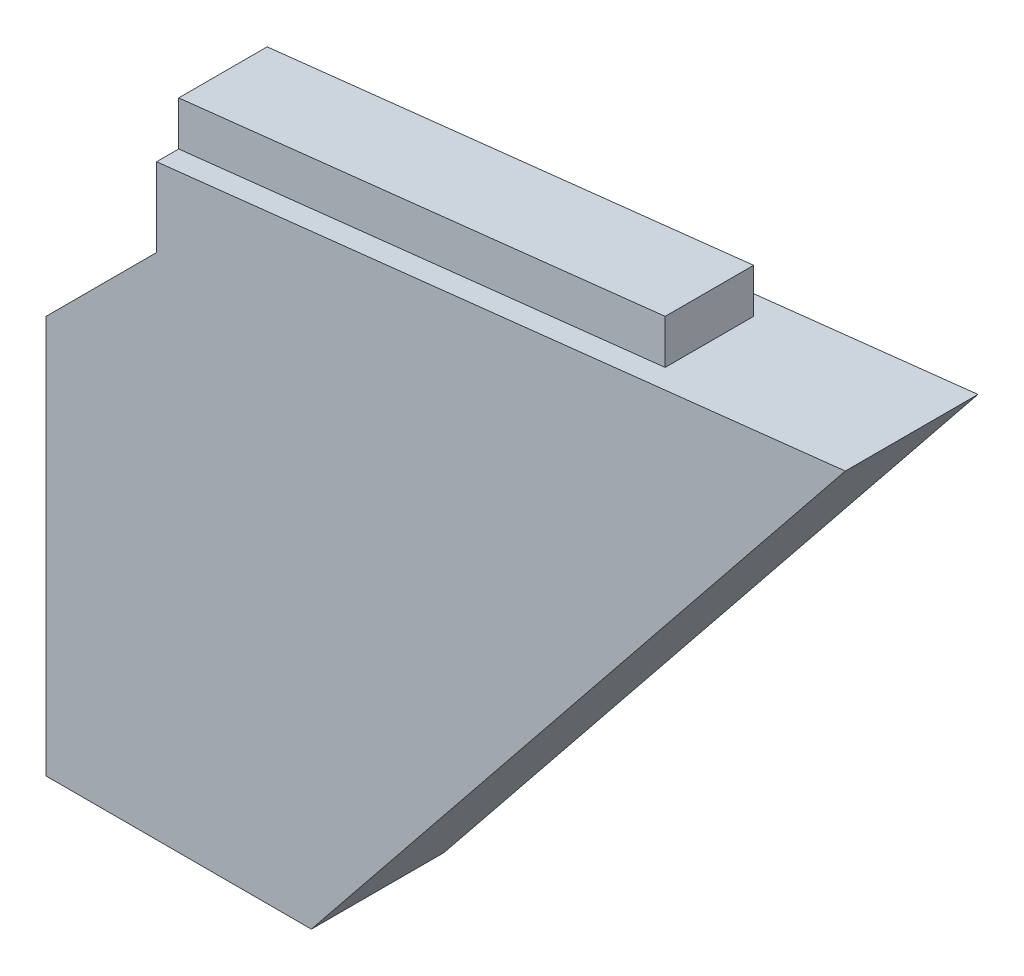
from build123d import *

# Parameters (mm, degrees)
BOSS_EXTRUDE1_DEPTH      = 1.5
SKETCH1_4_W              = 11
SKETCH1_4_H              = 2
BOSS_EXTRUDE2_DEPTH      = 1
BOSS_EXTRUDE3_DEPTH      = 0.5
BOSS_EXTRUDE3_DEPTH_BACK = 2.5
CUT_EXTRUDE1_DEPTH       = 2.5
CUT_EXTRUDE2_START       = -2
CUT_EXTRUDE2_DEPTH       = 2.5
CUT_EXTRUDE3_DEPTH       = 10
SKETCH5_W                = 11.067692947
SKETCH5_H                = 2
CUT_EXTRUDE4_DEPTH       = 1
CUT_EXTRUDE5_DEPTH       = 6
CUT_EXTRUDE6_DEPTH       = 6


with BuildPart() as part:
    # Sketch1 → Boss-Extrude1 (new, symmetric)
    with BuildSketch(Plane.XY):
        Polygon((-28.5, -6), (-39.5, -6), (-39.5, -9), (-42, -11.5), (-42, -20.5), (-36, -20.5), (-24.008925726, -8.508925726), (-21.5, -6), align=None)
    extrude(amount=BOSS_EXTRUDE1_DEPTH, both=True)

    # Sketch1<4> → Boss-Extrude2 (add, symmetric)
    with BuildSketch(Plane.XY):
        with Locations((-34, -5)):
            Rectangle(SKETCH1_4_W, SKETCH1_4_H)
    extrude(amount=BOSS_EXTRUDE2_DEPTH, both=True)

    # Sketch2 → Boss-Extrude3 (add, two sides: drawn at the far end of the back side and taken through both)
    with BuildSketch(Plane(origin=(0, 0, -1), x_dir=(-1, 0, 0), z_dir=(0, 0, -1)).offset(-BOSS_EXTRUDE3_DEPTH_BACK)):
        Polygon((21.5, -6), (28.5, -6), (20.625, -5.125), align=None)
    extrude(amount=BOSS_EXTRUDE3_DEPTH + BOSS_EXTRUDE3_DEPTH_BACK)

    # Sketch2<3> → Cut-Extrude1 (cut)
    with BuildSketch(Plane(origin=(0, 0, -1), x_dir=(-1, 0, 0), z_dir=(0, 0, -1))):
        Polygon((39.5, -7.222222222), (39.5, -6), (28.5, -6), align=None)
    extrude(amount=CUT_EXTRUDE1_DEPTH, mode=Mode.SUBTRACT)

    # Sketch2<4> → Cut-Extrude2 (cut)
    with BuildSketch(Plane(origin=(0, 0, -1), x_dir=(-1, 0, 0), z_dir=(0, 0, -1)).offset(CUT_EXTRUDE2_START)):
        Polygon((39.5, -7.222222222), (39.5, -6), (28.5, -6), align=None)
    extrude(amount=-CUT_EXTRUDE2_DEPTH, mode=Mode.SUBTRACT)

    # Sketch3 → Cut-Extrude3 (cut)
    with BuildSketch(Plane(origin=(0, 0, -1), x_dir=(-1, 0, 0), z_dir=(0, 0, -1))):
        Polygon((28.5, -4), (39.5, -5.222222222), (39.5, -4), align=None)
    extrude(amount=-CUT_EXTRUDE3_DEPTH, mode=Mode.SUBTRACT)

    # Sketch5 → Cut-Extrude4 (cut, along a direction that is not the sketch's normal)
    with BuildSketch(Plane(origin=(0.091463415, -0.823170732, 0), x_dir=(0.993883734673619, 0.11043152607484619, 0), z_dir=(-0.11043152607484619, 0.993883734673619, 0))):
        with Locations((-34.301259016, 0)):
            Rectangle(SKETCH5_W, SKETCH5_H)
    extrude(amount=-CUT_EXTRUDE4_DEPTH, dir=(0, 1, 0), mode=Mode.SUBTRACT)

    # Sketch6 → Cut-Extrude5 (cut)
    with BuildSketch(Plane(origin=(0, 0, -1.5), x_dir=(-1, 0, 0), z_dir=(0, 0, -1))):
        Polygon((22.46223447, -5.329137163), (22.29892474, -6.79892474), (20.531436433, -7.019526438), (20.056691247, -4.979132235), (21.915268146, -4.302367821), align=None)
    extrude(amount=-CUT_EXTRUDE5_DEPTH, mode=Mode.SUBTRACT)

    # Sketch7 → Cut-Extrude6 (cut)
    with BuildSketch(Plane(origin=(0, 0, -1.5), x_dir=(-1, 0, 0), z_dir=(0, 0, -1))):
        Polygon((22.29892474, -6.79892474), (36, -20.5), (23.926432251, -5.491825806), (22.46223447, -5.329137163), align=None)
    extrude(amount=-CUT_EXTRUDE6_DEPTH, mode=Mode.SUBTRACT)


solid = part.part
